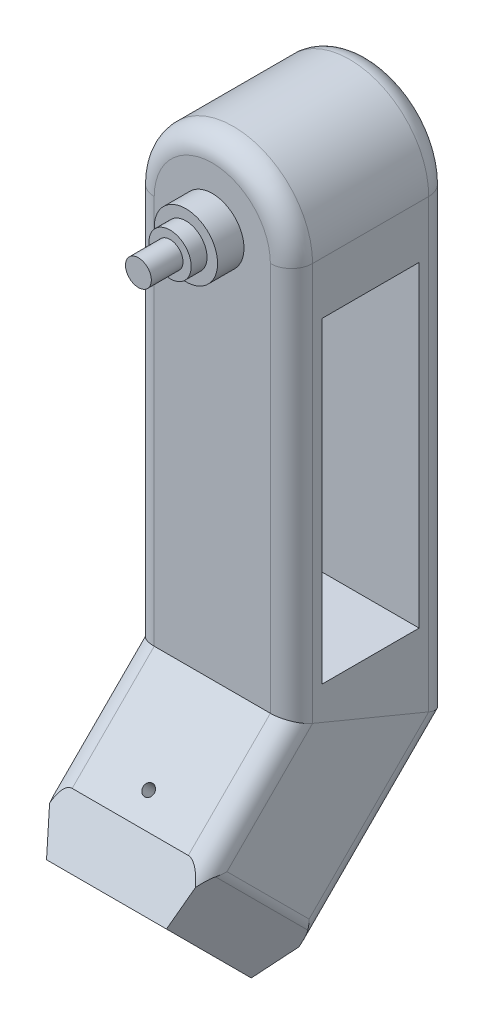
from build123d import *

# Parameters (mm, degrees)
SKETCH11_W          = 38.1
SKETCH11_H          = 38.1
SKETCH12_W          = 38.1
SKETCH12_H          = 38.1
BOSS_EXTRUDE5_DEPTH = 12.7
BOSS_EXTRUDE5_TAPER = 20
BOSS_EXTRUDE6_DEPTH = 38.1
SKETCH15_R          = 12.065
CUT_EXTRUDE3_DEPTH  = 25.4
SKETCH16_W          = 23.310601064
SKETCH16_H          = 76.2
CUT_EXTRUDE4_DEPTH  = 59.830675793
SKETCH17_R          = 7.62
BOSS_EXTRUDE7_DEPTH = 6.35
SKETCH18_R          = 5.08
BOSS_EXTRUDE8_DEPTH = 3.81
SKETCH19_R          = 3.1115
BOSS_EXTRUDE9_DEPTH = 7.62
FILLET2_R           = 5.08
SKETCH21_R          = 1.35
CUT_EXTRUDE5_DEPTH  = 63.348983198


with BuildPart() as part:
    # Sweep1: sweep along a path in Sketch10
    with BuildLine(Plane(origin=(0, 0, 0), x_dir=(0, 0, -1), z_dir=(1, 0, 0))) as sweep1_path:
        Line((0, 96.393), (0, -5.207))
        Line((0, -5.207), (-25.324322261, -30.531322261))
    # Sketch11 → Sweep1 (sweep)
    with BuildSketch(Plane(origin=(0, 96.393, 0), x_dir=(1, 0, 0), z_dir=(0, 1, 0))):
        Rectangle(SKETCH11_W, SKETCH11_H)
    sweep(path=sweep1_path.line, transition=Transition.RIGHT)

    # Sketch12 → Boss-Extrude5 (add)
    with BuildSketch(Plane(origin=(0, -27.927822261, 27.927822261), x_dir=(1, 0, 0), z_dir=(0, -0.7071067811865461, 0.7071067811865489))):
        with Locations((0, -3.68190501)):
            Rectangle(SKETCH12_W, SKETCH12_H)
    extrude(amount=BOSS_EXTRUDE5_DEPTH, taper=BOSS_EXTRUDE5_TAPER)

    # Sketch13 → Boss-Extrude6 (add)
    with BuildSketch(Plane(origin=(0, 0, -19.05), x_dir=(-1, 0, 0), z_dir=(0, 0, -1))):
        with BuildLine():
            Line((-19.05, 96.393), (19.05, 96.393))
            ThreePointArc((19.05, 96.393), (0, 115.443), (-19.05, 96.393))
        make_face()
    extrude(amount=-BOSS_EXTRUDE6_DEPTH)

    # Sketch15 → Cut-Extrude3 (cut)
    with BuildSketch(Plane(origin=(0, -36.908078382, 36.908078382), x_dir=(1, 0, 0), z_dir=(0, -0.7071067811865461, 0.7071067811865489))):
        with Locations(Location((0, -3.68190501, 0), (0, 0, 270))):
            Circle(SKETCH15_R)
    extrude(amount=-CUT_EXTRUDE3_DEPTH, mode=Mode.SUBTRACT)

    # Sketch16 → Cut-Extrude4 (cut)
    with BuildSketch(Plane(origin=(19.05, 0, 0), x_dir=(0, 0, -1), z_dir=(1, 0, 0))):
        with Locations((0, 45.72)):
            Rectangle(SKETCH16_W, SKETCH16_H)
    extrude(amount=-CUT_EXTRUDE4_DEPTH, mode=Mode.SUBTRACT)

    # Sketch17 → Boss-Extrude7 (add)
    with BuildSketch(Plane.XY.offset(19.05)):
        with Locations(Location((0, 96.393, 0), (0, 0, 90))):
            Circle(SKETCH17_R)
    extrude(amount=BOSS_EXTRUDE7_DEPTH)

    # Sketch18 → Boss-Extrude8 (add)
    with BuildSketch(Plane.XY.offset(25.4)):
        with Locations(Location((0, 96.393, 0), (0, 0, 180))):
            Circle(SKETCH18_R)
    extrude(amount=BOSS_EXTRUDE8_DEPTH)

    # Sketch19 → Boss-Extrude9 (add)
    with BuildSketch(Plane.XY.offset(29.21)):
        with Locations(Location((0, 96.393, 0), (0, 0, 180))):
            Circle(SKETCH19_R)
    extrude(amount=BOSS_EXTRUDE9_DEPTH)

    # Fillet2
    # the kernel refuses this fillet: 5.08 mm, written as the material it takes off along each edge
    with BuildSketch(Plane(origin=(19.05, 96.393, 19.05), x_dir=(-1, 0, 0), z_dir=(0, -1, 0))) as fillet2_piece_1_section:
        with BuildLine():
            CenterArc((FILLET2_R, FILLET2_R), FILLET2_R, 180, 90)
            Line((0, FILLET2_R), (0, 0))
            Line((0, 0), (FILLET2_R, 0))
        make_face()
    fillet2_piece_1 = extrude(amount=106.409231637, mode=Mode.PRIVATE)
    fillet2_piece_1 = split(fillet2_piece_1, bisect_by=Plane(origin=(17.892257619, 26.96392305, -5.230154687), z_dir=(0, 0.7071067811865489, 0.7071067811865462)), keep=Keep.TOP, mode=Mode.PRIVATE)
    add(fillet2_piece_1, mode=Mode.SUBTRACT)
    with BuildSketch(Plane(origin=(19.05, 96.393, -19.05), x_dir=(0, 0, 1), z_dir=(0, -1, 0))) as fillet2_piece_2:
        with BuildLine():
            CenterArc((FILLET2_R, FILLET2_R), FILLET2_R, 180, 90)
            Line((0, FILLET2_R), (0, 0))
            Line((0, 0), (FILLET2_R, 0))
        make_face()
    extrude(amount=122.190768363, mode=Mode.SUBTRACT)
    with BuildSketch(Plane(origin=(19.05, 11.664024484, 10.069743879), x_dir=(-1, 0, 0), z_dir=(0, -0.7071067811865462, 0.7071067811865489))) as fillet2_piece_3_section:
        with BuildLine():
            CenterArc((FILLET2_R, FILLET2_R), FILLET2_R, 180, 90)
            Line((0, FILLET2_R), (0, 0))
            Line((0, 0), (FILLET2_R, 0))
        make_face()
    fillet2_piece_3 = extrude(amount=53.323231637, mode=Mode.PRIVATE)
    fillet2_piece_3 = split(fillet2_piece_3, bisect_by=Plane(origin=(17.881962417, -12.866336341, 19.05), z_dir=(0, 0, 1)), keep=Keep.TOP, mode=Mode.PRIVATE)
    add(fillet2_piece_3, mode=Mode.SUBTRACT)
    with BuildSketch(Plane(origin=(19.05, -4.117512242, -28.030256121), x_dir=(0, 0.7071067811865489, 0.7071067811865462), z_dir=(0, -0.7071067811865462, 0.7071067811865489))) as fillet2_piece_4:
        with BuildLine():
            CenterArc((FILLET2_R, FILLET2_R), FILLET2_R, 180, 90)
            Line((0, FILLET2_R), (0, 0))
            Line((0, 0), (FILLET2_R, 0))
        make_face()
    extrude(amount=69.104768363, mode=Mode.SUBTRACT)
    with BuildSketch(Plane(origin=(-19.05, -4.117512242, -28.030256121), x_dir=(0, 0.7071067811865488, 0.7071067811865461), z_dir=(0, -0.7071067811865462, 0.7071067811865489))) as fillet2_piece_5:
        with BuildLine():
            CenterArc((FILLET2_R, -FILLET2_R), FILLET2_R, 90, 90)
            Line((0, -FILLET2_R), (0, 0))
            Line((0, 0), (FILLET2_R, 0))
        make_face()
    extrude(amount=69.104768363, mode=Mode.SUBTRACT)
    with BuildSketch(Plane(origin=(-19.05, 11.664024484, 10.069743879), x_dir=(0, -0.7071067811865489, -0.7071067811865462), z_dir=(0, -0.7071067811865462, 0.7071067811865489))) as fillet2_piece_6_section:
        with BuildLine():
            CenterArc((FILLET2_R, FILLET2_R), FILLET2_R, 180, 90)
            Line((0, FILLET2_R), (0, 0))
            Line((0, 0), (FILLET2_R, 0))
        make_face()
    fillet2_piece_6 = extrude(amount=53.323231637, mode=Mode.PRIVATE)
    fillet2_piece_6 = split(fillet2_piece_6, bisect_by=Plane(origin=(-17.881962417, -12.866336341, 19.05), z_dir=(0, 0, 1)), keep=Keep.TOP, mode=Mode.PRIVATE)
    add(fillet2_piece_6, mode=Mode.SUBTRACT)
    with BuildSketch(Plane(origin=(19.05, -15.477476632, 40.378167891), x_dir=(0, 0.7071067811865461, -0.7071067811865488), z_dir=(0, -0.7071067811865489, -0.7071067811865462)), Plane(origin=(-19.05, -45.585167891, 10.270476632), x_dir=(0, 0.7071067811865461, -0.7071067811865489), z_dir=(0, 0.7071067811865489, 0.7071067811865462))) as fillet2_piece_7:
        with BuildLine():
            CenterArc((FILLET2_R * 0.176326980708, -FILLET2_R), FILLET2_R, 90, 20)
            Line((-FILLET2_R * 0.165693162617, -FILLET2_R * 0.0603073792141), (0, 0))
            Line((0, 0), (FILLET2_R * 0.176326980708, 0))
        make_face()
    extrude(amount=42.57870531, mode=Mode.SUBTRACT)
    with BuildSketch(Plane(origin=(-19.05, 96.393, -19.05), x_dir=(0, 0, 1), z_dir=(0, -1, 0))) as fillet2_piece_8:
        with BuildLine():
            CenterArc((FILLET2_R, -FILLET2_R), FILLET2_R, 90, 90)
            Line((0, -FILLET2_R), (0, 0))
            Line((0, 0), (FILLET2_R, 0))
        make_face()
    extrude(amount=122.190768363, mode=Mode.SUBTRACT)
    with BuildSketch(Plane(origin=(-19.05, 96.393, 19.05), x_dir=(1, 0, 0), z_dir=(0, -1, 0))) as fillet2_piece_9_section:
        with BuildLine():
            CenterArc((FILLET2_R, -FILLET2_R), FILLET2_R, 90, 90)
            Line((0, -FILLET2_R), (0, 0))
            Line((0, 0), (FILLET2_R, 0))
        make_face()
    fillet2_piece_9 = extrude(amount=106.409231637, mode=Mode.PRIVATE)
    fillet2_piece_9 = split(fillet2_piece_9, bisect_by=Plane(origin=(-17.892257619, 26.96392305, -5.230154687), z_dir=(0, 0.7071067811865489, 0.7071067811865462)), keep=Keep.TOP, mode=Mode.PRIVATE)
    add(fillet2_piece_9, mode=Mode.SUBTRACT)
    with BuildSketch(Plane(origin=(0, 96.393, -19.05), x_dir=(-1, 0, 0), z_dir=(0, -1, 0))) as fillet2_piece_10:
        with BuildLine():
            CenterArc((19.05 - FILLET2_R, -FILLET2_R), FILLET2_R, 0, 90)
            Line((19.05 - FILLET2_R, 0), (19.05, 0))
            Line((19.05, 0), (19.05, -FILLET2_R))
        make_face()
    revolve(axis=Axis((0, 96.393, -19.05), (0, 0, -1)), revolution_arc=180, mode=Mode.SUBTRACT)
    with BuildSketch(Plane(origin=(0, 96.393, 19.05), x_dir=(-1, 0, 0), z_dir=(0, -1, 0))) as fillet2_piece_11:
        with BuildLine():
            CenterArc((19.05 - FILLET2_R, FILLET2_R), FILLET2_R, 270, 90)
            Line((19.05, FILLET2_R), (19.05, 0))
            Line((19.05, 0), (19.05 - FILLET2_R, 0))
        make_face()
    revolve(axis=Axis((0, 96.393, 19.05), (0, 0, -1)), revolution_arc=180, mode=Mode.SUBTRACT)
    with BuildSketch(Plane(origin=(19.05, 96.393, 19.05), x_dir=(-1, 0, 0), z_dir=(0, -1, 0))) as fillet2_piece_12a_section:
        with BuildLine():
            CenterArc((FILLET2_R, FILLET2_R), FILLET2_R, 180, 90)
            Line((0, FILLET2_R), (0, 0))
            Line((0, 0), (FILLET2_R, 0))
        make_face()
    fillet2_piece_12a = extrude(amount=106.409231637, mode=Mode.PRIVATE)
    fillet2_piece_12a = split(fillet2_piece_12a, bisect_by=Plane(origin=(17.951071981, 0.436282509, 21.297485854), z_dir=(0, -0.7071067811865489, -0.7071067811865462)), keep=Keep.TOP, mode=Mode.PRIVATE)
    with BuildSketch(Plane(origin=(19.05, 11.664024484, 10.069743879), x_dir=(-1, 0, 0), z_dir=(0, -0.7071067811865462, 0.7071067811865489))) as fillet2_piece_12b_section:
        with BuildLine():
            CenterArc((FILLET2_R, FILLET2_R), FILLET2_R, 180, 90)
            Line((0, FILLET2_R), (0, 0))
            Line((0, 0), (FILLET2_R, 0))
        make_face()
    fillet2_piece_12b = extrude(amount=53.323231637, mode=Mode.PRIVATE)
    fillet2_piece_12b = split(fillet2_piece_12b, bisect_by=Plane(origin=(17.951071981, 5.862193339, 19.05), z_dir=(0, 0, -1)), keep=Keep.TOP, mode=Mode.PRIVATE)
    fillet2_piece_12 = fillet2_piece_12a & fillet2_piece_12b
    add(fillet2_piece_12, mode=Mode.SUBTRACT)
    with BuildSketch(Plane(origin=(-19.05, 96.393, 19.05), x_dir=(1, 0, 0), z_dir=(0, -1, 0))) as fillet2_piece_13a_section:
        with BuildLine():
            CenterArc((FILLET2_R, -FILLET2_R), FILLET2_R, 90, 90)
            Line((0, -FILLET2_R), (0, 0))
            Line((0, 0), (FILLET2_R, 0))
        make_face()
    fillet2_piece_13a = extrude(amount=106.409231637, mode=Mode.PRIVATE)
    fillet2_piece_13a = split(fillet2_piece_13a, bisect_by=Plane(origin=(-17.951071981, 0.436282509, 21.297485854), z_dir=(0, -0.7071067811865489, -0.7071067811865462)), keep=Keep.TOP, mode=Mode.PRIVATE)
    with BuildSketch(Plane(origin=(-19.05, 11.664024484, 10.069743879), x_dir=(0, -0.7071067811865489, -0.7071067811865462), z_dir=(0, -0.7071067811865462, 0.7071067811865489))) as fillet2_piece_13b_section:
        with BuildLine():
            CenterArc((FILLET2_R, FILLET2_R), FILLET2_R, 180, 90)
            Line((0, FILLET2_R), (0, 0))
            Line((0, 0), (FILLET2_R, 0))
        make_face()
    fillet2_piece_13b = extrude(amount=53.323231637, mode=Mode.PRIVATE)
    fillet2_piece_13b = split(fillet2_piece_13b, bisect_by=Plane(origin=(-17.951071981, 5.862193339, 19.05), z_dir=(0, 0, -1)), keep=Keep.TOP, mode=Mode.PRIVATE)
    fillet2_piece_13 = fillet2_piece_13a & fillet2_piece_13b
    add(fillet2_piece_13, mode=Mode.SUBTRACT)

    # Sketch21 → Cut-Extrude5 (cut)
    with BuildSketch(Plane(origin=(0, -16.073884182, -16.073884182), x_dir=(1, 0, 0), z_dir=(0, -0.7071067811865486, -0.7071067811865465))):
        with Locations(Location((0, 33.23557837, 0), (0, 0, 270))):
            Circle(SKETCH21_R)
    extrude(amount=-CUT_EXTRUDE5_DEPTH, mode=Mode.SUBTRACT)


solid = part.part
